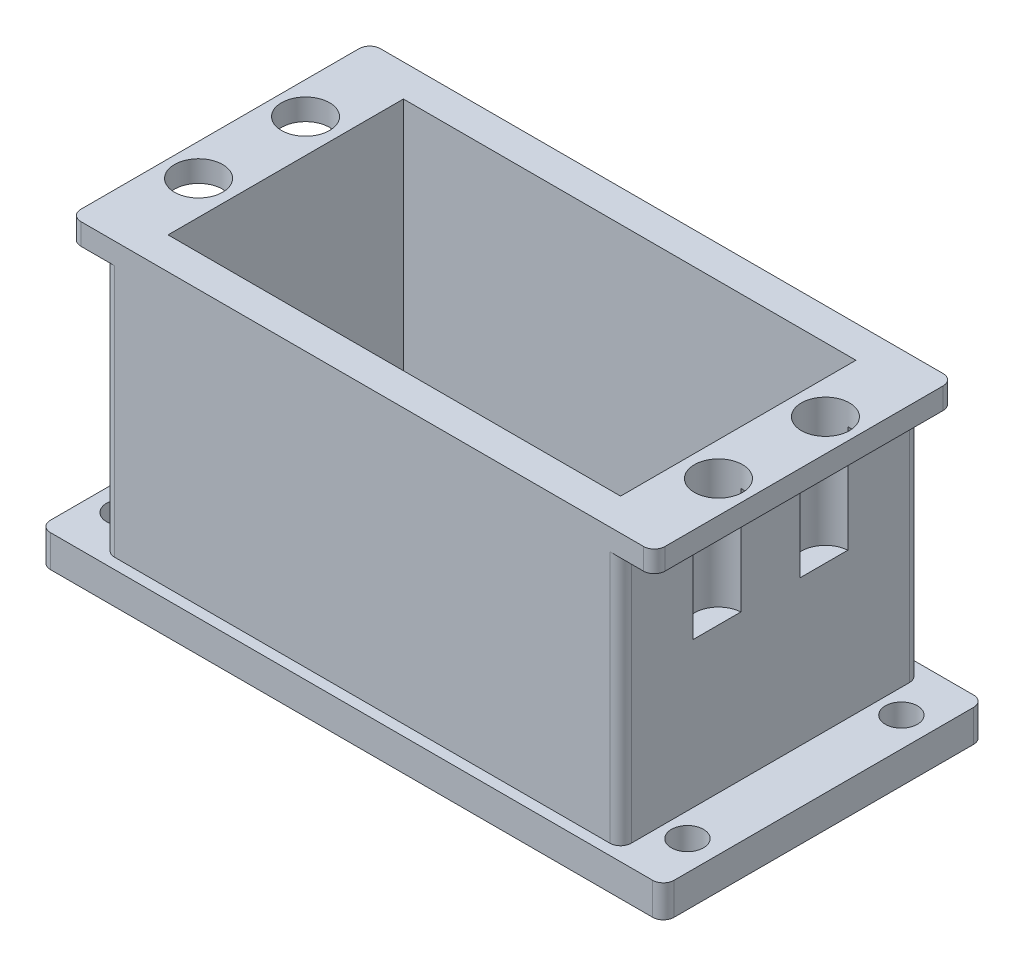
from build123d import *

# Parameters (mm, degrees)
SKETCH1_W           = 48.3
SKETCH1_H           = 28
SKETCH1_W_2         = 42.3
SKETCH1_H_2         = 22
BOSS_EXTRUDE1_DEPTH = 26.6
SKETCH2_W           = 54.6
SKETCH2_H           = 28
SKETCH2_W_2         = 42.3
SKETCH2_H_2         = 22
BOSS_EXTRUDE2_DEPTH = 2
SKETCH4_R           = 2.25
CUT_EXTRUDE1_DEPTH  = 12
SKETCH5_W           = 58.3
SKETCH5_H           = 30
SKETCH5_W_2         = 48.3
SKETCH5_H_2         = 28
BOSS_EXTRUDE3_DEPTH = 3
SKETCH6_W           = 10
SKETCH6_H           = 24
CUT_EXTRUDE2_DEPTH  = 10
SKETCH7_R           = 1.5
CUT_EXTRUDE3_DEPTH  = 10
FILLET1_R           = 1
FILLET2_R           = 1
FILLET3_R           = 1


with BuildPart() as part:
    # Sketch1 → Boss-Extrude1 (new body)
    with BuildSketch(Plane(origin=(0, 0, 0), x_dir=(1, 0, 0), z_dir=(0, 1, 0))):
        Rectangle(SKETCH1_W, SKETCH1_H)
        Rectangle(SKETCH1_W_2, SKETCH1_H_2, mode=Mode.SUBTRACT)
    extrude(amount=BOSS_EXTRUDE1_DEPTH)

    # Sketch2 → Boss-Extrude2 (add)
    with BuildSketch(Plane(origin=(0, 26.6, 0), x_dir=(1, 0, 0), z_dir=(0, 1, 0))):
        Rectangle(SKETCH2_W, SKETCH2_H)
        Rectangle(SKETCH2_W_2, SKETCH2_H_2, mode=Mode.SUBTRACT)
    extrude(amount=BOSS_EXTRUDE2_DEPTH)

    # Sketch4 → Cut-Extrude1 (cut)
    with BuildSketch(Plane(origin=(0, 28.6, 0), x_dir=(1, 0, 0), z_dir=(0, 1, 0))):
        with Locations((-24.3, 5)):
            Circle(SKETCH4_R)
        with Locations((-24.3, -5)):
            Circle(SKETCH4_R)
        with Locations((24.3, 5)):
            Circle(SKETCH4_R)
        with Locations((24.3, -5)):
            Circle(SKETCH4_R)
    extrude(amount=-CUT_EXTRUDE1_DEPTH, mode=Mode.SUBTRACT)

    # Sketch5 → Boss-Extrude3 (add)
    with BuildSketch(Plane.XZ):
        Rectangle(SKETCH5_W, SKETCH5_H)
        Rectangle(SKETCH5_W_2, SKETCH5_H_2, mode=Mode.SUBTRACT)
    extrude(amount=-BOSS_EXTRUDE3_DEPTH)

    # Sketch6 → Cut-Extrude2 (cut)
    with BuildSketch(Plane.ZY.offset(29.15)):
        Rectangle(SKETCH6_W, SKETCH6_H)
    extrude(amount=-CUT_EXTRUDE2_DEPTH, mode=Mode.SUBTRACT)

    # Sketch7 → Cut-Extrude3 (cut)
    with BuildSketch(Plane.XZ):
        with Locations((-26.4, 10)):
            Circle(SKETCH7_R)
        with Locations((-26.4, -10)):
            Circle(SKETCH7_R)
        with Locations((26.4, 10)):
            Circle(SKETCH7_R)
        with Locations((26.4, -10)):
            Circle(SKETCH7_R)
    extrude(amount=-CUT_EXTRUDE3_DEPTH, mode=Mode.SUBTRACT)

    # Fillet1
    fillet1_edges = [part.edges().sort_by_distance(p)[0] for p in [
        (24.15, 14.8, 14),
        (24.15, 14.8, -14),
        (-24.15, 14.8, -14),
        (-24.15, 14.8, 14),
    ]]
    fillet(fillet1_edges, radius=FILLET1_R)

    # Fillet2
    fillet2_edges = [part.edges().sort_by_distance(p)[0] for p in [
        (-27.3, 27.6, -14),
        (-27.3, 27.6, 14),
        (27.3, 27.6, 14),
        (27.3, 27.6, -14),
        (29.15, 1.5, 15),
        (29.15, 1.5, -15),
        (-29.15, 1.5, -5),
        (-29.15, 1.5, 15),
        (-29.15, 1.5, 5),
        (-29.15, 1.5, -15),
    ]]
    fillet(fillet2_edges, radius=FILLET2_R)

    # Fillet3
    fillet3_edges = [part.edges().sort_by_distance(p)[0] for p in [
        (-22.65, 12, -5),
        (-22.65, 12, 5),
    ]]
    fillet(fillet3_edges, radius=FILLET3_R)


solid = part.part
